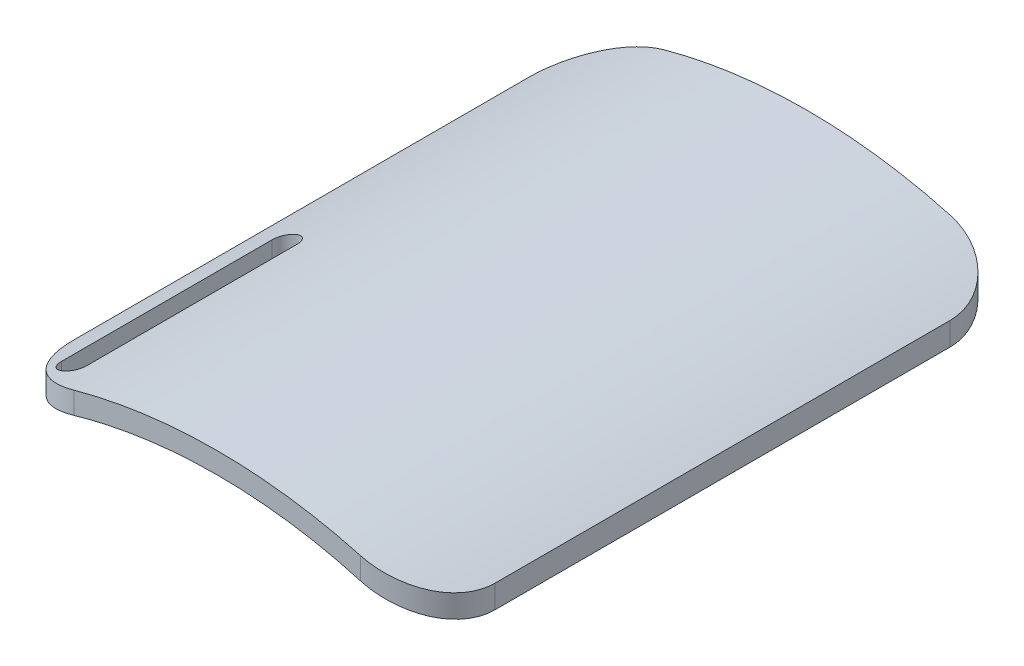
from build123d import *

# Parameters (mm, degrees)
BOSS_EXTRUDE1_START = -35
BOSS_EXTRUDE1_DEPTH = 70
CUT_EXTRUDE1_DEPTH  = 61.466933282
FILLET1_R           = 8


# Read off the part's stored shape, not the designer's step: Boss-Extrude1
with BuildPart() as part:
    # Boss-Extrude1 outline → Boss-Extrude1 (new body)
    with BuildSketch(Plane.XY.offset(BOSS_EXTRUDE1_START)):
        with BuildLine():
            Line((25, 34.641016151), (25, 37.382028889))
            add(Edge.make_bspline(
                [(25, 37.382028889), (23.499149868, 38.038900322), (20.42020332, 39.233525172), (12.247727699, 41.641473317), (0, 43.149082804), (-12.247727699, 41.641473317), (-20.42020332, 39.233525172), (-23.499149868, 38.038900322), (-25, 37.382028889)],
                knots=[1.070195568, 1.070195568, 1.070195568, 1.070195568, 1.168370339, 1.266545109, 1.570796327, 1.875047544, 1.973222315, 2.071397085, 2.071397085, 2.071397085, 2.071397085], degree=3))
            Line((-25, 37.382028889), (-25, 34.641016151))
            add(Edge.make_bspline(
                [(25, 34.641016151), (0, 46.188021535), (-25, 34.641016151)],
                knots=[1.047197551, 1.047197551, 1.047197551, 2.094395102, 2.094395102, 2.094395102], degree=2, weights=[1, 0.866025404, 1]))
        make_face()
    extrude(amount=BOSS_EXTRUDE1_DEPTH)

    # Sketch5 → Cut-Extrude1 (cut, through all)
    with BuildSketch(Plane(origin=(0, 0, 0), x_dir=(1, 0, 0), z_dir=(0, 1, 0))):
        with BuildLine():
            Line((-22.5, -31), (-22.5, -6))
            ThreePointArc((-22.5, -6), (-21, -4.5), (-19.5, -6))
            Line((-19.5, -6), (-19.5, -31))
            ThreePointArc((-19.5, -31), (-21, -32.5), (-22.5, -31))
        make_face()
    extrude(amount=CUT_EXTRUDE1_DEPTH, mode=Mode.SUBTRACT)

    # Fillet1
    # the kernel refuses this fillet: 8 mm, written as the material it takes off along each edge
    with BuildSketch(Plane(origin=(-25, 57.382028889, -35), x_dir=(0, 0, 1), z_dir=(0, -1, 0)), Plane(origin=(-25, 57.382028889, 35), x_dir=(1, 0, 0), z_dir=(0, -1, 0)), Plane(origin=(25, 14.641016151, -35), x_dir=(0, 0, 1), z_dir=(0, 1, 0))) as fillet1_piece_1:
        with BuildLine():
            CenterArc((FILLET1_R, -FILLET1_R), FILLET1_R, 90, 90)
            Line((0, -FILLET1_R), (0, 0))
            Line((0, 0), (FILLET1_R, 0))
        make_face()
    extrude(amount=42.741012738, mode=Mode.SUBTRACT)
    with BuildSketch(Plane(origin=(25, 14.641016151, 35), x_dir=(0, 0, -1), z_dir=(0, 1, 0))) as fillet1_piece_2:
        with BuildLine():
            CenterArc((FILLET1_R, FILLET1_R), FILLET1_R, 180, 90)
            Line((0, FILLET1_R), (0, 0))
            Line((0, 0), (FILLET1_R, 0))
        make_face()
    extrude(amount=42.741012738, mode=Mode.SUBTRACT)


solid = part.part
